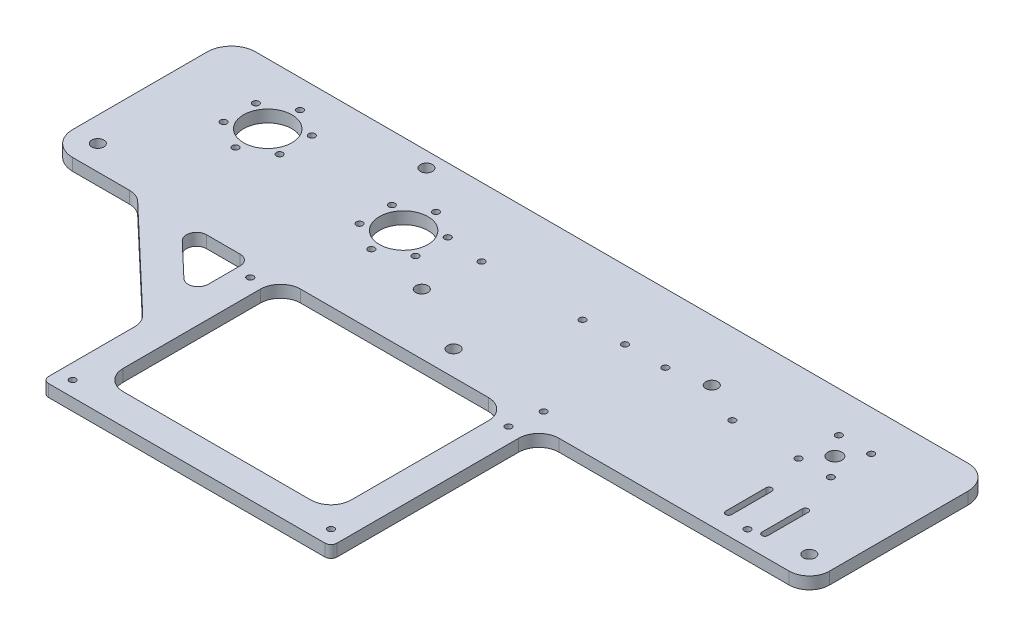
from build123d import *

# Parameters (mm, degrees)
ESBO_O1_R                = 1.6
ESBO_O1_R_2              = 3
ESBO_O1_R_3              = 12
ESBO_O1_R_4              = 3.5
RESSALTO_EXTRUS_O1_DEPTH = 6


with BuildPart() as part:
    # Esboço1 → Ressalto-extrusão1 (new body)
    with BuildSketch(Plane(origin=(0, 0, 0), x_dir=(1, 0, 0), z_dir=(0, 1, 0))):
        with BuildLine():
            Line((-85.527922956, -153.648697641), (51.472077044, -153.648697641))
            ThreePointArc((51.472077044, -153.648697641), (53.593397388, -152.770017984), (54.472077044, -150.648697641))
            Line((54.472077044, -150.648697641), (54.472077044, -60.648697641))
            ThreePointArc((54.472077044, -60.648697641), (57.401009232, -53.577629829), (64.472077044, -50.648697641))
            Line((64.472077044, -50.648697641), (178.527922956, -50.648697641))
            ThreePointArc((178.527922956, -50.648697641), (185.598990768, -47.719765453), (188.527922956, -40.648697641))
            Line((188.527922956, -40.648697641), (188.527922956, 28))
            ThreePointArc((188.527922956, 28), (185.01320433, 36.485281374), (176.527922956, 40))
            Line((176.527922956, 40), (-176.527922956, 40))
            ThreePointArc((-176.527922956, 40), (-185.01320433, 36.485281374), (-188.527922956, 28))
            Line((-188.527922956, 28), (-188.527922956, -38.648697641))
            ThreePointArc((-188.527922956, -38.648697641), (-185.01320433, -47.133979015), (-176.527922956, -50.648697641))
            Line((-176.527922956, -50.648697641), (-148.465622565, -50.648697641))
            ThreePointArc((-148.465622565, -50.648697641), (-144.756883762, -51.361865216), (-141.57713541, -53.399646343))
            Line((-141.57713541, -53.399646343), (-91.639435801, -100.853470046))
            ThreePointArc((-91.639435801, -100.853470046), (-89.338666415, -104.158213518), (-88.527922956, -108.102521344))
            Line((-88.527922956, -108.102521344), (-88.527922956, -150.648697641))
            ThreePointArc((-88.527922956, -150.648697641), (-87.649243299, -152.770017984), (-85.527922956, -153.648697641))
        make_face()
        with Locations((-81.027922956, -58.148697641)):
            Circle(ESBO_O1_R, mode=Mode.SUBTRACT)
        with Locations((-81.027922956, -146.148697641)):
            Circle(ESBO_O1_R, mode=Mode.SUBTRACT)
        with Locations((46.972077044, -58.148697641)):
            Circle(ESBO_O1_R, mode=Mode.SUBTRACT)
        with Locations((46.972077044, -146.148697641)):
            Circle(ESBO_O1_R, mode=Mode.SUBTRACT)
        with Locations((176.311042956, -38.431817641)):
            Circle(ESBO_O1_R_2, mode=Mode.SUBTRACT)
        with Locations((0, -38.431817641)):
            Circle(ESBO_O1_R_2, mode=Mode.SUBTRACT)
        with Locations((-140.527922956, 10)):
            Circle(ESBO_O1_R_3, mode=Mode.SUBTRACT)
        with Locations((-140.527922956, -6)):
            Circle(ESBO_O1_R, mode=Mode.SUBTRACT)
        with Locations((-154.384329416, 2)):
            Circle(ESBO_O1_R, mode=Mode.SUBTRACT)
        with Locations((-154.384329416, 18)):
            Circle(ESBO_O1_R, mode=Mode.SUBTRACT)
        with Locations((-84.367438628, 32.5)):
            Circle(ESBO_O1_R_2, mode=Mode.SUBTRACT)
        with Locations((-176.311042956, -38.431817641)):
            Circle(ESBO_O1_R_2, mode=Mode.SUBTRACT)
        with Locations((140.527922956, 10)):
            Circle(ESBO_O1_R_4, mode=Mode.SUBTRACT)
        with Locations((148.527922956, 0)):
            Circle(ESBO_O1_R, mode=Mode.SUBTRACT)
        with Locations((148.527922956, 20)):
            Circle(ESBO_O1_R, mode=Mode.SUBTRACT)
        with Locations((132.527922956, 0)):
            Circle(ESBO_O1_R, mode=Mode.SUBTRACT)
        with Locations((132.527922956, 20)):
            Circle(ESBO_O1_R, mode=Mode.SUBTRACT)
        with Locations((-140.527922956, 26)):
            Circle(ESBO_O1_R, mode=Mode.SUBTRACT)
        with Locations((-126.671516495, 18)):
            Circle(ESBO_O1_R, mode=Mode.SUBTRACT)
        with Locations((-126.671516495, 2)):
            Circle(ESBO_O1_R, mode=Mode.SUBTRACT)
        with Locations((-63.17160518, -16)):
            Circle(ESBO_O1_R, mode=Mode.SUBTRACT)
        with Locations((-77.02801164, -8)):
            Circle(ESBO_O1_R, mode=Mode.SUBTRACT)
        with Locations((-77.02801164, 8)):
            Circle(ESBO_O1_R, mode=Mode.SUBTRACT)
        with Locations((-63.17160518, 16)):
            Circle(ESBO_O1_R, mode=Mode.SUBTRACT)
        with Locations((-49.315198719, 8)):
            Circle(ESBO_O1_R, mode=Mode.SUBTRACT)
        with Locations((-49.315198719, -8)):
            Circle(ESBO_O1_R, mode=Mode.SUBTRACT)
        with Locations((-63.17160518, 0)):
            Circle(ESBO_O1_R_3, mode=Mode.SUBTRACT)
        with Locations((-33.527922956, -20.648697641)):
            Circle(ESBO_O1_R_2, mode=Mode.SUBTRACT)
        with Locations((79.527922956, 10)):
            Circle(ESBO_O1_R_2, mode=Mode.SUBTRACT)
        with Locations((99.722077044, 0)):
            Circle(ESBO_O1_R, mode=Mode.SUBTRACT)
        with Locations((49.222077044, -43)):
            Circle(ESBO_O1_R, mode=Mode.SUBTRACT)
        with Locations((150.222077044, -43)):
            Circle(ESBO_O1_R, mode=Mode.SUBTRACT)
        with Locations((-30.527922956, 6)):
            Circle(ESBO_O1_R, mode=Mode.SUBTRACT)
        with Locations((19.472077044, 6)):
            Circle(ESBO_O1_R, mode=Mode.SUBTRACT)
        with Locations((60.527922956, 6)):
            Circle(ESBO_O1_R, mode=Mode.SUBTRACT)
        with Locations((40.527922956, 6)):
            Circle(ESBO_O1_R, mode=Mode.SUBTRACT)
        with BuildLine():
            Line((-110.176410786, -50.648697641), (-93.527922956, -50.648697641))
            ThreePointArc((-93.527922956, -50.648697641), (-89.99238905, -52.113163735), (-88.527922956, -55.648697641))
            Line((-88.527922956, -55.648697641), (-88.527922956, -71.469098112))
            ThreePointArc((-88.527922956, -71.469098112), (-91.555769043, -76.063726382), (-96.972166533, -75.09362376))
            Line((-96.972166533, -75.09362376), (-113.620654363, -59.27322329))
            ThreePointArc((-113.620654363, -59.27322329), (-114.819826998, -53.794328239), (-110.176410786, -50.648697641))
        make_face(mode=Mode.SUBTRACT)
        with BuildLine():
            Line((39.472077044, -60.648697641), (39.472077044, -128.648697641))
            ThreePointArc((39.472077044, -128.648697641), (36.543144856, -135.719765453), (29.472077044, -138.648697641))
            Line((29.472077044, -138.648697641), (-63.527922956, -138.648697641))
            ThreePointArc((-63.527922956, -138.648697641), (-70.598990768, -135.719765453), (-73.527922956, -128.648697641))
            Line((-73.527922956, -128.648697641), (-73.527922956, -60.648697641))
            ThreePointArc((-73.527922956, -60.648697641), (-70.598990768, -53.577629829), (-63.527922956, -50.648697641))
            Line((-63.527922956, -50.648697641), (29.472077044, -50.648697641))
            ThreePointArc((29.472077044, -50.648697641), (36.543144856, -53.577629829), (39.472077044, -60.648697641))
        make_face(mode=Mode.SUBTRACT)
        with BuildLine():
            Line((155.027922956, -40.648697641), (155.027922956, -20.648697641))
            ThreePointArc((155.027922956, -20.648697641), (156.527922956, -19.148697641), (158.027922956, -20.648697641))
            Line((158.027922956, -20.648697641), (158.027922956, -40.648697641))
            ThreePointArc((158.027922956, -40.648697641), (156.527922956, -42.148697641), (155.027922956, -40.648697641))
        make_face(mode=Mode.SUBTRACT)
        with BuildLine():
            Line((140.027922956, -40.648697641), (140.027922956, -20.648697641))
            ThreePointArc((140.027922956, -20.648697641), (138.527922956, -19.148697641), (137.027922956, -20.648697641))
            Line((137.027922956, -20.648697641), (137.027922956, -40.648697641))
            ThreePointArc((137.027922956, -40.648697641), (138.527922956, -42.148697641), (140.027922956, -40.648697641))
        make_face(mode=Mode.SUBTRACT)
    extrude(amount=-RESSALTO_EXTRUS_O1_DEPTH)


solid = part.part
